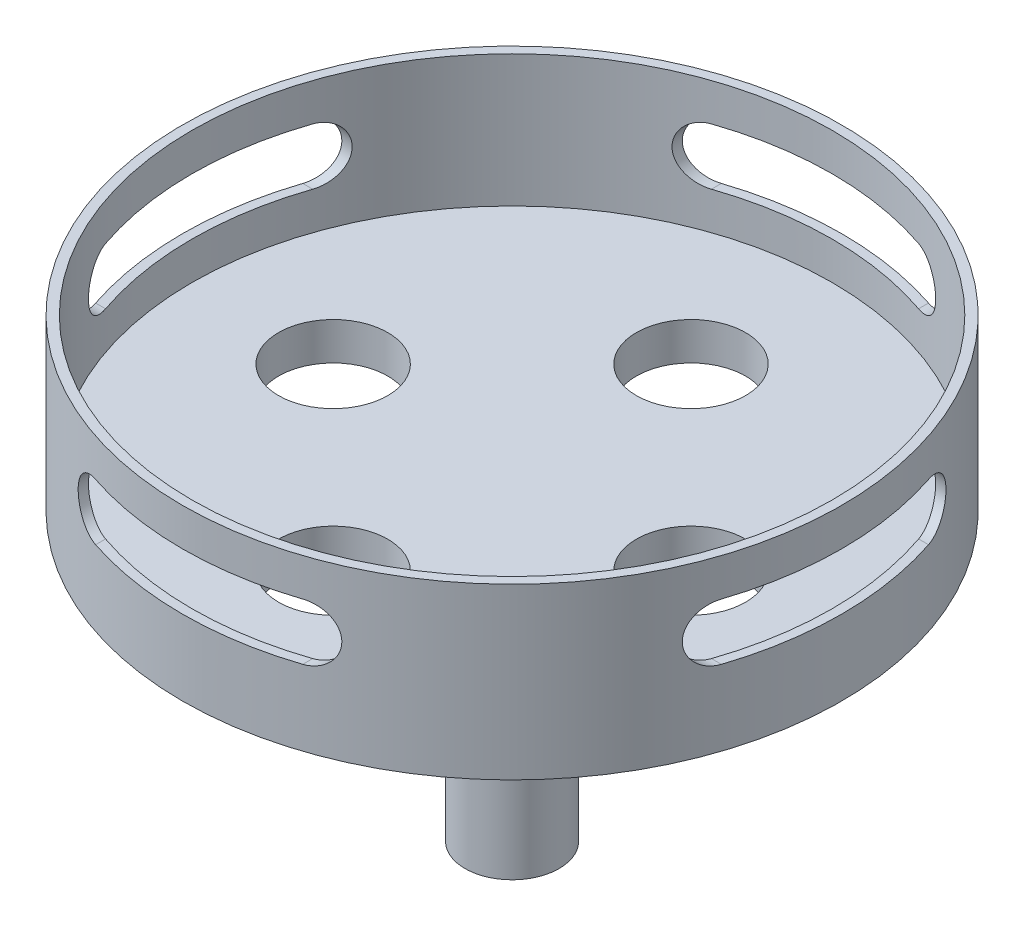
from build123d import *

# Parameters (mm, degrees)
IZIM1_R                     = 17.5
IZIM1_R_2                   = 17
Y_KSEKLIK_EKSTR_ZYON1_DEPTH = 9
KAL_NLA_T_R1_OUTLINE_R      = 17
KAL_NLA_T_R1_DEPTH          = 2
IZIM2_R                     = 2.9
KES_EKSTR_ZYON1_DEPTH       = 9
KES_EKSTR_ZYON5_DEPTH       = 43.349734356
DAIRESEL_KAPLAMA1_COUNT     = 2
DAIRESEL_KAPLAMA1_ANGLE     = 90
IZIM4_R                     = 5.5
Y_KSEKLIK_EKSTR_ZYON2_DEPTH = 4.2
IZIM5_R                     = 2.5
Y_KSEKLIK_EKSTR_ZYON3_DEPTH = 11


# Read off the part's stored shape, not the designer's step: Kalınlaştır1
with BuildPart() as part:
    # Çizim1 → Yükseklik-Ekstrüzyon1 (new body)
    with BuildSketch(Plane(origin=(0, 0, 0), x_dir=(1, 0, 0), z_dir=(0, 1, 0))):
        with Locations(Location((0, 0, 0), (0, 0, 270))):
            Circle(IZIM1_R)
        with Locations(Location((0, 0, 0), (0, 0, 270))):
            Circle(IZIM1_R_2, mode=Mode.SUBTRACT)
    extrude(amount=Y_KSEKLIK_EKSTR_ZYON1_DEPTH)

    # Kalınlaştır1 outline → Kalınlaştır1 (add)
    with BuildSketch(Plane(origin=(0, 0, 0), x_dir=(1, 0, 0), z_dir=(0, 1, 0))):
        Circle(KAL_NLA_T_R1_OUTLINE_R)
    extrude(amount=KAL_NLA_T_R1_DEPTH)

    # Çizim2 → Kes-Ekstrüzyon1 (cut)
    with BuildSketch(Plane(origin=(0, 2, 0), x_dir=(1, 0, 0), z_dir=(0, 1, 0))):
        with Locations(Location((-9.5, 0, 0), (0, 0, 270))):
            Circle(IZIM2_R)
        with Locations(Location((0, 9.5, 0), (0, 0, 270))):
            Circle(IZIM2_R)
        with Locations(Location((9.5, 0, 0), (0, 0, 270))):
            Circle(IZIM2_R)
        with Locations(Location((0, -9.5, 0), (0, 0, 270))):
            Circle(IZIM2_R)
    extrude(amount=-KES_EKSTR_ZYON1_DEPTH, mode=Mode.SUBTRACT)

    # Çizim3 → Kes-Ekstrüzyon5 (cut, symmetric)
    with BuildSketch(Plane.ZY.offset(-20)):
        with BuildLine():
            Line((-5.5, 7), (5.5, 7))
            ThreePointArc((5.5, 7), (7, 5.5), (5.5, 4))
            Line((5.5, 4), (-5.5, 4))
            ThreePointArc((-5.5, 4), (-7, 5.5), (-5.5, 7))
        make_face()
    kes_ekstr_zyon5 = extrude(amount=KES_EKSTR_ZYON5_DEPTH, both=True, mode=Mode.SUBTRACT)

    # Dairesel Kaplama1: Kes-Ekstrüzyon5 ×2 about axis
    dairesel_kaplama1_axis = Axis((0, 2, 0), (0, 1, 0))
    for i in range(1, DAIRESEL_KAPLAMA1_COUNT):
        add(kes_ekstr_zyon5.rotate(dairesel_kaplama1_axis, i * DAIRESEL_KAPLAMA1_ANGLE / (DAIRESEL_KAPLAMA1_COUNT - 1)), mode=Mode.SUBTRACT)

    # Çizim4 → Yükseklik-Ekstrüzyon2 (add)
    with BuildSketch(Plane.XZ):
        with Locations(Location((0, 0, 0), (0, 0, 90))):
            Circle(IZIM4_R)
    extrude(amount=Y_KSEKLIK_EKSTR_ZYON2_DEPTH)

    # Çizim5 → Yükseklik-Ekstrüzyon3 (add)
    with BuildSketch(Plane.XZ.offset(4.2)):
        with Locations(Location((0, 0, 0), (0, 0, 270))):
            Circle(IZIM5_R)
    extrude(amount=Y_KSEKLIK_EKSTR_ZYON3_DEPTH)


solid = part.part
